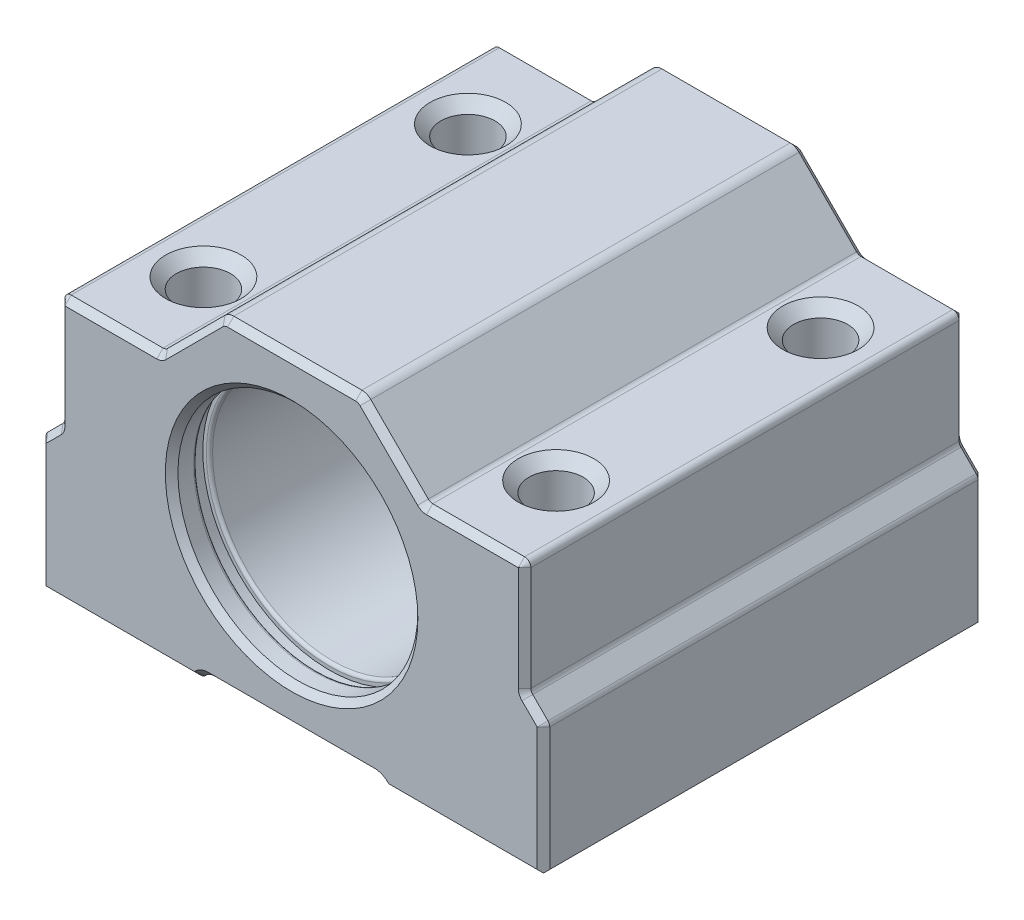
from build123d import *

# Parameters (mm, degrees)
SKETCH1_R                      = 9.525
BOSS_EXTRUDE1_DEPTH            = 35
CHAMFER2_SIZE                  = 0.5
SKETCH2_W                      = 1
SKETCH2_H                      = 0.55
FILLET2_R                      = 0.25
M5X0_8_TAPPED_HOLE1_AT_2_COUNT = 2
M5X0_8_TAPPED_HOLE1_AT_2_PITCH = 21
M5X0_8_TAPPED_HOLE1_AT_3_COUNT = 2
M5X0_8_TAPPED_HOLE1_AT_3_PITCH = 35
M5X0_8_TAPPED_HOLE1_AT_4_COUNT = 2
M5X0_8_TAPPED_HOLE1_AT_4_PITCH = 28
CHAMFER3_SIZE                  = 0.5


with BuildPart() as part:
    # Sketch1 → Boss-Extrude1 (new body)
    with BuildSketch(Plane.XY):
        with BuildLine():
            Line((18.646446609, -1.146446609), (19.853553391, -2.353553391))
            ThreePointArc((19.853553391, -2.353553391), (19.961939766, -2.515765065), (20, -2.707106781))
            Line((20, -2.707106781), (20, -12.5))
            Line((20, -12.5), (19.5, -13))
            Line((19.5, -13), (7.707106781, -13))
            ThreePointArc((7.707106781, -13), (7.515765065, -12.961939766), (7.353553391, -12.853553391))
            Line((7.353553391, -12.853553391), (7.292893219, -12.792893219))
            ThreePointArc((7.292893219, -12.792893219), (6.96846987, -12.576120467), (6.585786438, -12.5))
            Line((6.585786438, -12.5), (-6.585786438, -12.5))
            ThreePointArc((-6.585786438, -12.5), (-6.96846987, -12.576120467), (-7.292893219, -12.792893219))
            Line((-7.292893219, -12.792893219), (-7.353553391, -12.853553391))
            ThreePointArc((-7.353553391, -12.853553391), (-7.515765065, -12.961939766), (-7.707106781, -13))
            Line((-7.707106781, -13), (-19.5, -13))
            Line((-19.5, -13), (-20, -12.5))
            Line((-20, -12.5), (-20, -2.707106781))
            ThreePointArc((-20, -2.707106781), (-19.961939766, -2.515765065), (-19.853553391, -2.353553391))
            Line((-19.853553391, -2.353553391), (-18.646446609, -1.146446609))
            ThreePointArc((-18.646446609, -1.146446609), (-18.538060234, -0.984234935), (-18.5, -0.792893219))
            Line((-18.5, -0.792893219), (-18.5, 7.5))
            ThreePointArc((-18.5, 7.5), (-18.353553391, 7.853553391), (-18, 8))
            Line((-18, 8), (-10.707106781, 8))
            ThreePointArc((-10.707106781, 8), (-10.515765065, 8.038060234), (-10.353553391, 8.146446609))
            Line((-10.353553391, 8.146446609), (-5.792893219, 12.707106781))
            ThreePointArc((-5.792893219, 12.707106781), (-5.46846987, 12.923879533), (-5.085786438, 13))
            Line((-5.085786438, 13), (5.085786438, 13))
            ThreePointArc((5.085786438, 13), (5.46846987, 12.923879533), (5.792893219, 12.707106781))
            Line((5.792893219, 12.707106781), (10.353553391, 8.146446609))
            ThreePointArc((10.353553391, 8.146446609), (10.515765065, 8.038060234), (10.707106781, 8))
            Line((10.707106781, 8), (18, 8))
            ThreePointArc((18, 8), (18.353553391, 7.853553391), (18.5, 7.5))
            Line((18.5, 7.5), (18.5, -0.792893219))
            ThreePointArc((18.5, -0.792893219), (18.538060234, -0.984234935), (18.646446609, -1.146446609))
        make_face()
        with Locations(Location((0, 0, 0), (0, 0, 180))):
            Circle(SKETCH1_R, mode=Mode.SUBTRACT)
    extrude(amount=BOSS_EXTRUDE1_DEPTH)

    # Chamfer2
    chamfer2_edges = [part.edges().sort_by_distance(p)[0] for p in [
        (9.525, 0, 0),
        (9.525, 0, 35),
    ]]
    chamfer(chamfer2_edges, length=CHAMFER2_SIZE)

    # Sketch2 → Cut-Revolve1 (revolve, cut)
    with BuildSketch(Plane(origin=(0, 0, 0), x_dir=(0, 0, -1), z_dir=(1, 0, 0)), mode=Mode.PRIVATE) as cut_revolve1_sk:
        with Locations((-32.5, -9.775)):
            Rectangle(SKETCH2_W, SKETCH2_H)
        with Locations((-2.5, -9.775)):
            Rectangle(SKETCH2_W, SKETCH2_H)
    revolve(cut_revolve1_sk.sketch.rotate(Axis((0, 0, 0), (0, 0, 1)), 270), axis=Axis((0, 0, 0), (0, 0, 1)), mode=Mode.SUBTRACT)

    # Fillet2
    fillet2_edges = [part.edges().sort_by_distance(p)[0] for p in [
        (9.525, 0, 33),
        (9.525, 0, 32),
        (9.525, 0, 3),
        (9.525, 0, 2),
    ]]
    fillet(fillet2_edges, radius=FILLET2_R)

    # Sketch5 → M5x0.8 Tapped Hole1 (revolve, cut)
    with BuildSketch(Plane(origin=(-14, -13, 28), x_dir=(0, 0, -1), z_dir=(1, 0, 0))):
        Polygon((0, 0), (0, 21), (3, 21), (2.15, 20.15), (2.15, 1.35), (3.5, 0), align=None)
    m5x0_8_tapped_hole1 = revolve(axis=Axis((-14, -19.35, 28), (0, 1, 0)), mode=Mode.SUBTRACT)

    # M5x0.8 Tapped Hole1 at 2: M5x0.8 Tapped Hole1 ×2
    with Locations(*[(0, 0, -i * M5X0_8_TAPPED_HOLE1_AT_2_PITCH) for i in range(1, M5X0_8_TAPPED_HOLE1_AT_2_COUNT)]):
        add(m5x0_8_tapped_hole1, mode=Mode.SUBTRACT)

    # M5x0.8 Tapped Hole1 at 3: M5x0.8 Tapped Hole1 ×2
    with Locations(*[Vector(0.8, 0, -0.6) * (i * M5X0_8_TAPPED_HOLE1_AT_3_PITCH) for i in range(1, M5X0_8_TAPPED_HOLE1_AT_3_COUNT)]):
        add(m5x0_8_tapped_hole1, mode=Mode.SUBTRACT)

    # M5x0.8 Tapped Hole1 at 4: M5x0.8 Tapped Hole1 ×2
    with Locations(*[(i * M5X0_8_TAPPED_HOLE1_AT_4_PITCH, 0, 0) for i in range(1, M5X0_8_TAPPED_HOLE1_AT_4_COUNT)]):
        add(m5x0_8_tapped_hole1, mode=Mode.SUBTRACT)

    # Chamfer3
    chamfer3_edges = [part.edges().sort_by_distance(p)[0] for p in [
        (18.353553391, 7.853553391, 0),
        (18.5, 3.353553391, 0),
        (18.538060234, -0.984234935, 0),
        (19.25, -1.75, 0),
        (19.961939766, -2.515765065, 0),
        (20, -7.603553391, 0),
        (-20, -7.603553391, 0),
        (-19.961939766, -2.515765065, 0),
        (-19.25, -1.75, 0),
        (-18.538060234, -0.984234935, 0),
        (-18.5, 3.353553391, 0),
        (-18.353553391, 7.853553391, 0),
        (-14.353553391, 8, 0),
        (-10.515765065, 8.038060234, 0),
        (-8.073223305, 10.426776695, 0),
        (-5.46846987, 12.923879533, 0),
        (0, 13, 0),
        (5.46846987, 12.923879533, 0),
        (8.073223305, 10.426776695, 0),
        (10.515765065, 8.038060234, 0),
        (14.353553391, 8, 0),
    ]]
    chamfer(chamfer3_edges, length=CHAMFER3_SIZE - 0.0001)  # a hair under: the kernel refuses the full size
    chamfer3_2_edges = [part.edges().sort_by_distance(p)[0] for p in [
        (13.603553391, -13, 0),
        (7.515765065, -12.961939766, 0),
        (7.323223305, -12.823223305, 0),
        (6.96846987, -12.576120467, 0),
        (0, -12.5, 0),
        (-6.96846987, -12.576120467, 0),
        (-7.323223305, -12.823223305, 0),
        (-7.515765065, -12.961939766, 0),
        (-13.603553391, -13, 0),
    ]]
    chamfer(chamfer3_2_edges, length=CHAMFER3_SIZE - 0.0001)  # a hair under: the kernel refuses the full size
    chamfer3_3_edges = [part.edges().sort_by_distance(p)[0] for p in [
        (18.353553391, 7.853553391, 35),
        (18.5, 3.353553391, 35),
        (18.538060234, -0.984234935, 35),
        (19.25, -1.75, 35),
        (19.961939766, -2.515765065, 35),
        (20, -7.603553391, 35),
        (-20, -7.603553391, 35),
        (-19.961939766, -2.515765065, 35),
        (-19.25, -1.75, 35),
        (-18.538060234, -0.984234935, 35),
        (-18.5, 3.353553391, 35),
        (-18.353553391, 7.853553391, 35),
        (-14.353553391, 8, 35),
        (-10.515765065, 8.038060234, 35),
        (-8.073223305, 10.426776695, 35),
        (-5.46846987, 12.923879533, 35),
        (0, 13, 35),
        (5.46846987, 12.923879533, 35),
        (8.073223305, 10.426776695, 35),
        (10.515765065, 8.038060234, 35),
        (14.353553391, 8, 35),
    ]]
    chamfer(chamfer3_3_edges, length=CHAMFER3_SIZE - 0.0001)  # a hair under: the kernel refuses the full size
    chamfer3_4_edges = [part.edges().sort_by_distance(p)[0] for p in [
        (13.603553391, -13, 35),
        (7.515765065, -12.961939766, 35),
        (7.323223305, -12.823223305, 35),
        (6.96846987, -12.576120467, 35),
        (0, -12.5, 35),
        (-6.96846987, -12.576120467, 35),
        (-7.323223305, -12.823223305, 35),
        (-7.515765065, -12.961939766, 35),
        (-13.603553391, -13, 35),
    ]]
    chamfer(chamfer3_4_edges, length=CHAMFER3_SIZE - 0.0001)  # a hair under: the kernel refuses the full size


solid = part.part
